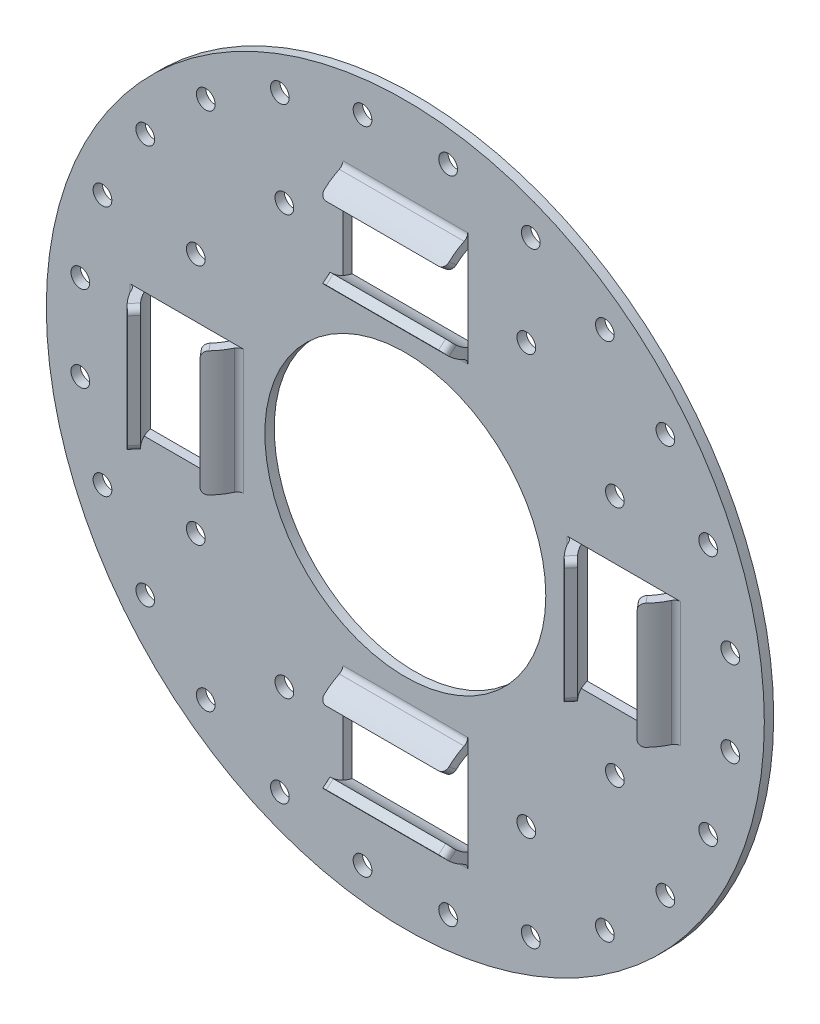
from build123d import *
from OCP.BRepAlgoAPI import BRepAlgoAPI_Cut
from OCP.TopTools import TopTools_ListOfShape

# Parameters (mm, degrees)
SKETCH1_R                    = 57.5
SKETCH1_R_2                  = 22.5
PLATE_DEPTH                  = 1.5
SKETCH2_R                    = 1.5
OUTER_RIVET_HOLES_DEPTH      = 82.331113358
CIRPATTERN1_COUNT            = 24
SKETCH3_W                    = 20
SKETCH3_H                    = 15.1
SPRING_CUT_OUT_DEPTH         = 82.331113358
CUT_OUT_CIRPATTERN_COUNT     = 4
SPRING_RETAINER_DEPTH        = 20
SPRING_RETAINER_2_DEPTH      = 20
RETAINER_START               = -10
RETAINER_CIRPATTERN_DEPTH    = 20
RETAINER_CIRPATTERN_2_DEPTH  = 20
FILLET1_R                    = 1
FILLET_START                 = -16.968101369
FILLET_CIRPATTERN_DEPTH      = 47.968101369
FILLET_START_2               = -31
FILLET_CIRPATTERN_2_DEPTH    = 2.972968691
FILLET_CIRPATTERN_3_DEPTH    = 47.968101369
FILLET_CIRPATTERN_4_DEPTH    = 2.968101369
FILLET2_R                    = 1
SKETCH5_R                    = 1.5
PLATE_RIVET_HOLES_DEPTH      = 82.400628353
RIVET_HOLES_CIRPATTERN_COUNT = 4


with BuildPart() as part:
    # Sketch1 → Plate (new body)
    with BuildSketch(Plane.XY):
        Circle(SKETCH1_R)
        Circle(SKETCH1_R_2, mode=Mode.SUBTRACT)
    extrude(amount=PLATE_DEPTH)

    # Sketch2 → Outer Rivet Holes (cut, through all)
    with BuildSketch(Plane.XY.offset(1.5)):
        with Locations((-6.852625092, 52.050855222)):
            Circle(SKETCH2_R)
    outer_rivet_holes = extrude(amount=-OUTER_RIVET_HOLES_DEPTH, mode=Mode.SUBTRACT)

    # CirPattern1: Outer Rivet Holes ×24 about axis
    cirpattern1_axis = Axis((0, 0, 0), (0, 0, 1))
    for i in range(1, CIRPATTERN1_COUNT):
        add(outer_rivet_holes.rotate(cirpattern1_axis, i * 360 / CIRPATTERN1_COUNT), mode=Mode.SUBTRACT)

    # Sketch3 → Spring Cut Out (cut, through all)
    with BuildSketch(Plane.XY.offset(1.5)):
        with Locations((0, 35)):
            Rectangle(SKETCH3_W, SKETCH3_H)
    spring_cut_out = extrude(amount=-SPRING_CUT_OUT_DEPTH, mode=Mode.SUBTRACT)

    # Cut Out CirPattern: Spring Cut Out ×4 about axis
    cut_out_cirpattern_axis = Axis((0, 0, 0), (0, 0, 1))
    for i in range(1, CUT_OUT_CIRPATTERN_COUNT):
        add(spring_cut_out.rotate(cut_out_cirpattern_axis, i * 360 / CUT_OUT_CIRPATTERN_COUNT), mode=Mode.SUBTRACT)

    # Retainer CirPattern: read off the stored shape, not the designer's step
    # Retainer CirPattern outline → Retainer CirPattern (add)
    with BuildSketch(Plane(origin=(0, 0, 0), x_dir=(1, 0, 0), z_dir=(0, 1, 0)).offset(RETAINER_START)):
        with BuildLine():
            Line((-27.45, 0), (-27.655614389, 0))
            ThreePointArc((-27.655614389, 0), (-28.576458051, -2.217443615), (-30.146953547, -4.033635546))
            Line((-30.146953547, -4.033635546), (-29.182772132, -5.18270221))
            ThreePointArc((-29.182772132, -5.18270221), (-27.63436102, -3.508313647), (-26.553699034, -1.5))
            Line((-26.553699034, -1.5), (-27.45, -1.5))
            Line((-27.45, -1.5), (-27.45, 0))
        make_face()
        with BuildLine():
            Line((-42.344385611, 0), (-42.55, 0))
            Line((-42.55, 0), (-42.55, -1.5))
            Line((-42.55, -1.5), (-43.446300966, -1.5))
            ThreePointArc((-43.446300966, -1.5), (-42.36563898, -3.508313647), (-40.817227868, -5.18270221))
            Line((-40.817227868, -5.18270221), (-39.853046453, -4.033635546))
            ThreePointArc((-39.853046453, -4.033635546), (-41.423541949, -2.217443615), (-42.344385611, 0))
        make_face()
        with BuildLine():
            Line((27.655614389, 0), (27.45, 0))
            Line((27.45, 0), (27.45, -1.5))
            Line((27.45, -1.5), (26.553699034, -1.5))
            ThreePointArc((26.553699034, -1.5), (27.63436102, -3.508313647), (29.182772132, -5.18270221))
            Line((29.182772132, -5.18270221), (30.146953547, -4.033635546))
            ThreePointArc((30.146953547, -4.033635546), (28.576458051, -2.217443615), (27.655614389, 0))
        make_face()
        with BuildLine():
            Line((42.55, 0), (42.344385611, 0))
            ThreePointArc((42.344385611, 0), (41.423541949, -2.217443615), (39.853046453, -4.033635546))
            Line((39.853046453, -4.033635546), (40.817227868, -5.18270221))
            ThreePointArc((40.817227868, -5.18270221), (42.36563898, -3.508313647), (43.446300966, -1.5))
            Line((43.446300966, -1.5), (42.55, -1.5))
            Line((42.55, -1.5), (42.55, 0))
        make_face()
    extrude(amount=RETAINER_CIRPATTERN_DEPTH)

    # Retainer CirPattern 2 outline → Retainer CirPattern 2 (add)
    with BuildSketch(Plane.YZ.offset(RETAINER_START)):
        with BuildLine():
            Line((-27.655614389, 0), (-27.45, 0))
            Line((-27.45, 0), (-27.45, 1.5))
            Line((-27.45, 1.5), (-26.553699034, 1.5))
            ThreePointArc((-26.553699034, 1.5), (-27.63436102, 3.508313647), (-29.182772132, 5.18270221))
            Line((-29.182772132, 5.18270221), (-30.146953547, 4.033635546))
            ThreePointArc((-30.146953547, 4.033635546), (-28.576458051, 2.217443615), (-27.655614389, 0))
        make_face()
        with BuildLine():
            Line((-42.55, 0), (-42.344385611, 0))
            ThreePointArc((-42.344385611, 0), (-41.423541949, 2.217443615), (-39.853046453, 4.033635546))
            Line((-39.853046453, 4.033635546), (-40.817227868, 5.18270221))
            ThreePointArc((-40.817227868, 5.18270221), (-42.36563898, 3.508313647), (-43.446300966, 1.5))
            Line((-43.446300966, 1.5), (-42.55, 1.5))
            Line((-42.55, 1.5), (-42.55, 0))
        make_face()
    extrude(amount=RETAINER_CIRPATTERN_2_DEPTH)


with BuildPart() as body_2:
    # Sketch4 → Spring Retainer (new body)
    with BuildSketch(Plane(origin=(-10, 0, 0), x_dir=(0, 0, -1), z_dir=(1, 0, 0))):
        with BuildLine():
            Line((0, 43.879189152), (0, 42.344385611))
            ThreePointArc((0, 42.344385611), (-2.217443614, 41.423541949), (-4.033635546, 39.853046453))
            Line((-4.033635546, 39.853046453), (-5.18270221, 40.817227868))
            ThreePointArc((-5.18270221, 40.817227868), (-2.853393438, 42.791743634), (0, 43.879189152))
        make_face()
    extrude(amount=SPRING_RETAINER_DEPTH)


with BuildPart() as body_3:
    # Sketch4 → Spring Retainer 2 (new body)
    with BuildSketch(Plane(origin=(-10, 0, 0), x_dir=(0, 0, -1), z_dir=(1, 0, 0))):
        with BuildLine():
            Line((-4.033635546, 30.146953547), (-5.18270221, 29.182772132))
            ThreePointArc((-5.18270221, 29.182772132), (-2.853393438, 27.208256366), (0, 26.120810848))
            Line((0, 26.120810848), (0, 27.655614389))
            ThreePointArc((0, 27.655614389), (-2.217443614, 28.576458051), (-4.033635546, 30.146953547))
        make_face()
    extrude(amount=SPRING_RETAINER_2_DEPTH)


with BuildPart() as part_1:
    add(part.part)

    # Combine1: union body 3, body 2
    add(body_3.part)
    add(body_2.part)

    # Fillet1
    fillet1_edges = [part_1.edges().sort_by_distance(p)[0] for p in [
        (-10, 29.66486284, 4.608168878),
        (10, 29.66486284, 4.608168878),
        (-10, 40.33513716, 4.608168878),
        (10, 40.33513716, 4.608168878),
    ]]
    fillet(fillet1_edges, radius=FILLET1_R)


with BuildPart() as fillet_cirpattern_tool:
    # Fillet CirPattern: read off the stored shape, not the designer's step
    # Fillet CirPattern outline → Fillet CirPattern (new body)
    with BuildSketch(Plane(origin=(0, 0, 0), x_dir=(0.7660444431189717, 0, -0.6427876096865469), z_dir=(0.6427876096865469, 0, 0.7660444431189718)).offset(FILLET_START)):
        with BuildLine():
            Line((27.936433826, 10), (27.936433826, 9))
            ThreePointArc((27.936433826, 9), (28.229327045, 9.707106781), (28.936433826, 10))
            Line((28.936433826, 10), (27.936433826, 10))
        make_face()
        with BuildLine():
            ThreePointArc((28.936433826, -10), (28.229327045, -9.707106781), (27.936433826, -9))
            Line((27.936433826, -9), (27.936433826, -10))
            Line((27.936433826, -10), (28.936433826, -10))
        make_face()
        with BuildLine():
            Line((-25.686677192, 10), (-25.686677192, 9))
            ThreePointArc((-25.686677192, 9), (-25.393783973, 9.707106781), (-24.686677192, 10))
            Line((-24.686677192, 10), (-25.686677192, 10))
        make_face()
        with BuildLine():
            ThreePointArc((-24.686677192, -10), (-25.393783973, -9.707106781), (-25.686677192, -9))
            Line((-25.686677192, -9), (-25.686677192, -10))
            Line((-25.686677192, -10), (-24.686677192, -10))
        make_face()
    extrude(amount=FILLET_CIRPATTERN_DEPTH)


with BuildPart() as part_2:
    add(part_1.part)

    # Fillet CirPattern: cut by fillet_cirpattern_tool, with a tolerance
    fillet_cirpattern_stock = TopTools_ListOfShape()
    fillet_cirpattern_stock.Append(part_2.part.wrapped)
    fillet_cirpattern_tools = TopTools_ListOfShape()
    fillet_cirpattern_tools.Append(fillet_cirpattern_tool.part.wrapped)
    fillet_cirpattern_cut = BRepAlgoAPI_Cut()
    fillet_cirpattern_cut.SetArguments(fillet_cirpattern_stock)
    fillet_cirpattern_cut.SetTools(fillet_cirpattern_tools)
    fillet_cirpattern_cut.SetFuzzyValue(0.00001)
    fillet_cirpattern_cut.Build()
    add(Compound.cast(fillet_cirpattern_cut.Shape()).solids(), mode=Mode.REPLACE)


with BuildPart() as fillet_cirpattern_2_tool:
    # Fillet CirPattern 2 outline → Fillet CirPattern 2 (new body)
    with BuildSketch(Plane(origin=(0, 0, 0), x_dir=(1, 0, 0), z_dir=(0, 0.6427876096865469, -0.7660444431189718)).offset(FILLET_START_2)):
        with BuildLine():
            Line((-10, 27.936433826), (-9, 27.936433826))
            ThreePointArc((-9, 27.936433826), (-9.707106781, 28.229327045), (-10, 28.936433826))
            Line((-10, 28.936433826), (-10, 27.936433826))
        make_face()
        with BuildLine():
            ThreePointArc((10, 28.936433826), (9.707106781, 28.229327045), (9, 27.936433826))
            Line((9, 27.936433826), (10, 27.936433826))
            Line((10, 27.936433826), (10, 28.936433826))
        make_face()
    extrude(amount=FILLET_CIRPATTERN_2_DEPTH)


with BuildPart() as part_3:
    add(part_2.part)

    # Fillet CirPattern 2: cut by fillet_cirpattern_2_tool, with a tolerance
    fillet_cirpattern_2_stock = TopTools_ListOfShape()
    fillet_cirpattern_2_stock.Append(part_3.part.wrapped)
    fillet_cirpattern_2_tools = TopTools_ListOfShape()
    fillet_cirpattern_2_tools.Append(fillet_cirpattern_2_tool.part.wrapped)
    fillet_cirpattern_2_cut = BRepAlgoAPI_Cut()
    fillet_cirpattern_2_cut.SetArguments(fillet_cirpattern_2_stock)
    fillet_cirpattern_2_cut.SetTools(fillet_cirpattern_2_tools)
    fillet_cirpattern_2_cut.SetFuzzyValue(0.00001)
    fillet_cirpattern_2_cut.Build()
    add(Compound.cast(fillet_cirpattern_2_cut.Shape()).solids(), mode=Mode.REPLACE)


with BuildPart() as fillet_cirpattern_3_tool:
    # Fillet CirPattern 3 outline → Fillet CirPattern 3 (new body)
    with BuildSketch(Plane(origin=(0, 0, 0), x_dir=(0.7660444431189717, 0, 0.6427876096865469), z_dir=(0.6427876096865469, 0, -0.7660444431189718)).offset(FILLET_START_2)):
        with BuildLine():
            Line((-27.936433826, -10), (-27.936433826, -9))
            ThreePointArc((-27.936433826, -9), (-28.229327045, -9.707106781), (-28.936433826, -10))
            Line((-28.936433826, -10), (-27.936433826, -10))
        make_face()
        with BuildLine():
            ThreePointArc((-28.936433826, 10), (-28.229327045, 9.707106781), (-27.936433826, 9))
            Line((-27.936433826, 9), (-27.936433826, 10))
            Line((-27.936433826, 10), (-28.936433826, 10))
        make_face()
        with BuildLine():
            Line((25.686677192, -10), (25.686677192, -9))
            ThreePointArc((25.686677192, -9), (25.393783973, -9.707106781), (24.686677192, -10))
            Line((24.686677192, -10), (25.686677192, -10))
        make_face()
        with BuildLine():
            ThreePointArc((24.686677192, 10), (25.393783973, 9.707106781), (25.686677192, 9))
            Line((25.686677192, 9), (25.686677192, 10))
            Line((25.686677192, 10), (24.686677192, 10))
        make_face()
    extrude(amount=FILLET_CIRPATTERN_3_DEPTH)


with BuildPart() as part_4:
    add(part_3.part)

    # Fillet CirPattern 3: cut by fillet_cirpattern_3_tool, with a tolerance
    fillet_cirpattern_3_stock = TopTools_ListOfShape()
    fillet_cirpattern_3_stock.Append(part_4.part.wrapped)
    fillet_cirpattern_3_tools = TopTools_ListOfShape()
    fillet_cirpattern_3_tools.Append(fillet_cirpattern_3_tool.part.wrapped)
    fillet_cirpattern_3_cut = BRepAlgoAPI_Cut()
    fillet_cirpattern_3_cut.SetArguments(fillet_cirpattern_3_stock)
    fillet_cirpattern_3_cut.SetTools(fillet_cirpattern_3_tools)
    fillet_cirpattern_3_cut.SetFuzzyValue(0.00001)
    fillet_cirpattern_3_cut.Build()
    add(Compound.cast(fillet_cirpattern_3_cut.Shape()).solids(), mode=Mode.REPLACE)


with BuildPart() as fillet_cirpattern_4_tool:
    # Fillet CirPattern 4 outline → Fillet CirPattern 4 (new body)
    with BuildSketch(Plane(origin=(0, 0, 0), x_dir=(1, 0, 0), z_dir=(0, 0.6427876096865381, 0.7660444431189791)).offset(FILLET_START)):
        with BuildLine():
            Line((-10, -25.686677192), (-9, -25.686677192))
            ThreePointArc((-9, -25.686677192), (-9.707106781, -25.393783973), (-10, -24.686677192))
            Line((-10, -24.686677192), (-10, -25.686677192))
        make_face()
        with BuildLine():
            ThreePointArc((10, -24.686677192), (9.707106781, -25.393783973), (9, -25.686677192))
            Line((9, -25.686677192), (10, -25.686677192))
            Line((10, -25.686677192), (10, -24.686677192))
        make_face()
    extrude(amount=FILLET_CIRPATTERN_4_DEPTH)


with BuildPart() as part_5:
    add(part_4.part)

    # Fillet CirPattern 4: cut by fillet_cirpattern_4_tool, with a tolerance
    fillet_cirpattern_4_stock = TopTools_ListOfShape()
    fillet_cirpattern_4_stock.Append(part_5.part.wrapped)
    fillet_cirpattern_4_tools = TopTools_ListOfShape()
    fillet_cirpattern_4_tools.Append(fillet_cirpattern_4_tool.part.wrapped)
    fillet_cirpattern_4_cut = BRepAlgoAPI_Cut()
    fillet_cirpattern_4_cut.SetArguments(fillet_cirpattern_4_stock)
    fillet_cirpattern_4_cut.SetTools(fillet_cirpattern_4_tools)
    fillet_cirpattern_4_cut.SetFuzzyValue(0.00001)
    fillet_cirpattern_4_cut.Build()
    add(Compound.cast(fillet_cirpattern_4_cut.Shape()).solids(), mode=Mode.REPLACE)

    # Fillet2
    fillet2_edges = [part_5.edges().sort_by_distance(p)[0] for p in [
        (-26.553699034, 0, 1.5),
        (0, -26.553699034, 1.5),
        (26.553699034, 0, 1.5),
        (-43.446300966, 0, 1.5),
        (0, -43.446300966, 1.5),
        (43.446300966, 0, 1.5),
        (0, 26.553699034, 1.5),
        (0, 43.446300966, 1.5),
    ]]
    fillet(fillet2_edges, radius=FILLET2_R)

    # Sketch5 → Plate Rivet Holes (cut, through all)
    with BuildSketch(Plane.XY.offset(1.5)):
        with Locations((19.375, 33.558484397)):
            Circle(SKETCH5_R)
        with Locations((33.558484397, 19.375)):
            Circle(SKETCH5_R)
    plate_rivet_holes = extrude(amount=-PLATE_RIVET_HOLES_DEPTH, mode=Mode.SUBTRACT)

    # Rivet Holes CirPattern: Plate Rivet Holes ×4 about axis
    rivet_holes_cirpattern_axis = Axis((0, 0, 0), (0, 0, 1))
    for i in range(1, RIVET_HOLES_CIRPATTERN_COUNT):
        add(plate_rivet_holes.rotate(rivet_holes_cirpattern_axis, i * 360 / RIVET_HOLES_CIRPATTERN_COUNT), mode=Mode.SUBTRACT)


solid = part_5.part
